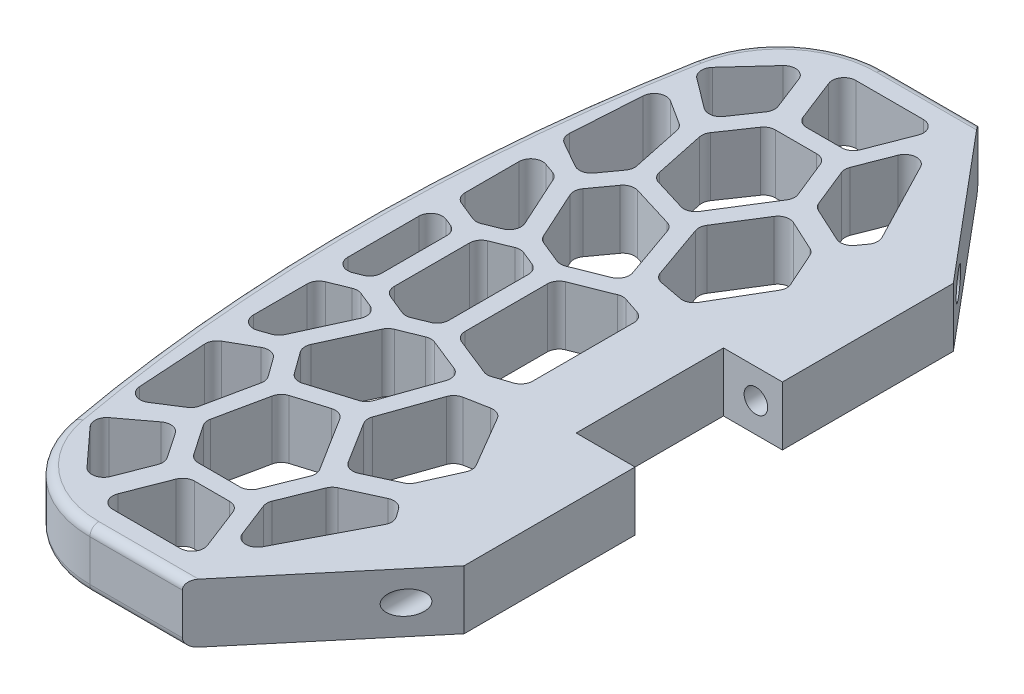
from build123d import *

# Parameters (mm, degrees)
BOSS_EXTRUDE1_DEPTH     = 10
FILLET1_R               = 3
CUT_EXTRUDE1_DEPTH      = 181.900525226
CUT_EXTRUDE1_DEPTH_BACK = 181.900525226
SKETCH2_R               = 4


with BuildPart() as part:
    # Sketch1 → Boss-Extrude1 (new, symmetric)
    with BuildSketch(Plane(origin=(0, 0, 0), x_dir=(1, 0, 0), z_dir=(0, 1, 0))):
        with BuildLine():
            Line((0, 25), (0, 83))
            Line((0, 83), (-43.633180821, 135))
            Line((-43.633180821, 135), (-75, 135))
            ThreePointArc((-75, 135), (-98.046638388, 126.655966066), (-110.409836066, 105.491803279))
            ThreePointArc((-110.409836066, 105.491803279), (-120, 0), (-110.409836066, -105.491803279))
            ThreePointArc((-110.409836066, -105.491803279), (-98.046638388, -126.655966066), (-75, -135))
            Line((-75, -135), (-43.633180821, -135))
            Line((-43.633180821, -135), (0, -83))
            Line((0, -83), (0, -25))
            Line((0, -25), (-20, -25))
            Line((-20, -25), (-20, 25))
            Line((-20, 25), (0, 25))
        make_face()
        with BuildLine():
            Line((-92.903661411, -118.071048963), (-104.314416206, -105.622682832))
            ThreePointArc((-104.314416206, -105.622682832), (-105.348741321, -102.551111688), (-103.768152023, -99.721603743))
            Line((-103.768152023, -99.721603743), (-93.663418974, -92.131293511))
            ThreePointArc((-93.663418974, -92.131293511), (-90.607698285, -91.383223133), (-87.95611023, -93.07618474))
            Line((-87.95611023, -93.07618474), (-82.152909795, -101.58768978))
            ThreePointArc((-82.152909795, -101.58768978), (-81.483446176, -103.389106237), (-81.731391874, -105.294835944))
            Line((-81.731391874, -105.294835944), (-86.228570564, -116.822007268))
            ThreePointArc((-86.228570564, -116.822007268), (-89.219305628, -119.29994155), (-92.903661411, -118.071048963))
        make_face(mode=Mode.SUBTRACT)
        with BuildLine():
            Line((-107.716713798, -85.45480826), (-109.185897217, -61.87312516))
            ThreePointArc((-109.185897217, -61.87312516), (-108.711796874, -59.721098426), (-107.16993739, -58.146722508))
            Line((-107.16993739, -58.146722508), (-98.591441924, -53.271722356))
            ThreePointArc((-98.591441924, -53.271722356), (-95.765108561, -52.840762765), (-93.373030139, -54.406600328))
            Line((-93.373030139, -54.406600328), (-88.867294221, -60.641919189))
            ThreePointArc((-88.867294221, -60.641919189), (-88.196501553, -62.154552316), (-88.195310047, -63.809248772))
            Line((-88.195310047, -63.809248772), (-91.802216554, -80.931458777))
            ThreePointArc((-91.802216554, -80.931458777), (-92.427915772, -82.384305249), (-93.567892012, -83.480989595))
            Line((-93.567892012, -83.480989595), (-101.57603347, -88.580143981))
            ThreePointArc((-101.57603347, -88.580143981), (-105.538804361, -88.770929923), (-107.716713798, -85.45480826))
        make_face(mode=Mode.SUBTRACT)
        with BuildLine():
            Line((-53.243197888, -126.067380558), (-76.169198798, -126.067380558))
            ThreePointArc((-76.169198798, -126.067380558), (-79.471871946, -124.324004158), (-79.895643883, -120.613555595))
            Line((-79.895643883, -120.613555595), (-74.359923873, -106.424394489))
            ThreePointArc((-74.359923873, -106.424394489), (-72.890102388, -104.575546304), (-70.633478788, -103.878219453))
            Line((-70.633478788, -103.878219453), (-58.751784972, -103.878219453))
            ThreePointArc((-58.751784972, -103.878219453), (-56.492419781, -104.577421226), (-55.022930664, -106.430584985))
            Line((-55.022930664, -106.430584985), (-49.51434358, -120.619746091))
            ThreePointArc((-49.51434358, -120.619746091), (-49.942399661, -124.326745749), (-53.243197888, -126.067380558))
        make_face(mode=Mode.SUBTRACT)
        with BuildLine():
            ThreePointArc((-85.489708732, -86.042690057), (-86.108665781, -84.565985031), (-86.098877878, -82.964838643))
            Line((-86.098877878, -82.964838643), (-82.455180266, -65.66797897))
            ThreePointArc((-82.455180266, -65.66797897), (-81.492665055, -63.792848275), (-79.71061556, -62.667303851))
            Line((-79.71061556, -62.667303851), (-68.758995788, -59.318917468))
            ThreePointArc((-68.758995788, -59.318917468), (-66.191217311, -59.396469443), (-64.200172027, -61.019811457))
            Line((-64.200172027, -61.019811457), (-52.796960318, -79.213385644))
            ThreePointArc((-52.796960318, -79.213385644), (-52.201794736, -80.985423607), (-52.476819935, -82.834396769))
            Line((-52.476819935, -82.834396769), (-57.536730596, -95.374919235))
            ThreePointArc((-57.536730596, -95.374919235), (-59.008619742, -97.193849041), (-61.246163135, -97.878219453))
            Line((-61.246163135, -97.878219453), (-75.306136497, -97.878219453))
            ThreePointArc((-75.306136497, -97.878219453), (-77.175189091, -97.414692611), (-78.611063662, -96.131540654))
            Line((-78.611063662, -96.131540654), (-85.489708732, -86.042690057))
        make_face(mode=Mode.SUBTRACT)
        with BuildLine():
            ThreePointArc((-104.132666249, -48.855802133), (-107.776081705, -48.351345011), (-109.467200853, -45.084990895))
            Line((-109.467200853, -45.084990895), (-109.467200853, -26.785450362))
            ThreePointArc((-109.467200853, -26.785450362), (-108.785731431, -24.552211727), (-106.973523452, -23.079915013))
            Line((-106.973523452, -23.079915013), (-100.549048075, -20.468326798))
            ThreePointArc((-100.549048075, -20.468326798), (-99.042725476, -20.173862148), (-97.536402877, -20.468326798))
            Line((-97.536402877, -20.468326798), (-92.429437297, -22.544339288))
            ThreePointArc((-92.429437297, -22.544339288), (-90.218255908, -24.773336762), (-90.297464245, -27.912043328))
            Line((-90.297464245, -27.912043328), (-98.337911629, -45.511655757))
            ThreePointArc((-98.337911629, -45.511655757), (-99.275493757, -46.800105046), (-100.641672676, -47.620298304))
            Line((-100.641672676, -47.620298304), (-104.132666249, -48.855802133))
        make_face(mode=Mode.SUBTRACT)
        with BuildLine():
            ThreePointArc((-90.632060101, -47.955570863), (-91.370518919, -46.006541571), (-91.028243615, -43.950602801))
            Line((-91.028243615, -43.950602801), (-83.466307585, -27.398396567))
            ThreePointArc((-83.466307585, -27.398396567), (-82.595792825, -26.17276524), (-81.334334533, -25.355029908))
            Line((-81.334334533, -25.355029908), (-73.785358558, -22.286325378))
            ThreePointArc((-73.785358558, -22.286325378), (-72.291756772, -21.991880956), (-70.796312421, -22.276819556))
            Line((-70.796312421, -22.276819556), (-59.788001344, -26.670386462))
            ThreePointArc((-59.788001344, -26.670386462), (-57.628848621, -28.731118927), (-57.497437693, -31.71294554))
            Line((-57.497437693, -31.71294554), (-63.878784021, -49.851045401))
            ThreePointArc((-63.878784021, -49.851045401), (-64.88305062, -51.410138826), (-66.482539605, -52.348732827))
            Line((-66.482539605, -52.348732827), (-80.925996583, -56.764725681))
            ThreePointArc((-80.925996583, -56.764725681), (-83.369608001, -56.731184975), (-85.337640324, -55.282319721))
            Line((-85.337640324, -55.282319721), (-90.632060101, -47.955570863))
        make_face(mode=Mode.SUBTRACT)
        with BuildLine():
            Line((-47.043977303, -111.24493966), (-51.583510871, -99.551891667))
            ThreePointArc((-51.583510871, -99.551891667), (-51.854569543, -98.077872496), (-51.564089102, -96.607557417))
            Line((-51.564089102, -96.607557417), (-46.327796918, -83.629889594))
            ThreePointArc((-46.327796918, -83.629889594), (-45.513232816, -82.366202314), (-44.289692518, -81.492492205))
            Line((-44.289692518, -81.492492205), (-32.712336522, -76.168044361))
            ThreePointArc((-32.712336522, -76.168044361), (-30.01966596, -75.934731591), (-27.793296277, -77.467111323))
            Line((-27.793296277, -77.467111323), (-25.858537821, -80.158099404))
            ThreePointArc((-25.858537821, -80.158099404), (-25.116544676, -82.206333495), (-25.557952149, -84.3396352))
            Line((-25.557952149, -84.3396352), (-39.766825217, -111.643810779))
            ThreePointArc((-39.766825217, -111.643810779), (-43.53404012, -113.791310112), (-47.043977303, -111.24493966))
        make_face(mode=Mode.SUBTRACT)
        with BuildLine():
            ThreePointArc((-58.867702773, -58.229870235), (-59.45388757, -56.547806551), (-59.251697806, -54.778040986))
            Line((-59.251697806, -54.778040986), (-52.741129763, -36.27264616))
            ThreePointArc((-52.741129763, -36.27264616), (-51.5738241, -34.565553665), (-49.709944902, -33.669606327))
            Line((-49.709944902, -33.669606327), (-41.851396628, -32.185886366))
            ThreePointArc((-41.851396628, -32.185886366), (-39.453295699, -32.475335944), (-37.659082514, -34.092576856))
            Line((-37.659082514, -34.092576856), (-27.485532771, -51.436056894))
            ThreePointArc((-27.485532771, -51.436056894), (-26.941717734, -53.241406998), (-27.28533147, -55.095309205))
            Line((-27.28533147, -55.095309205), (-32.572892381, -66.897900524))
            ThreePointArc((-32.572892381, -66.897900524), (-33.377285177, -68.073239302), (-34.542494472, -68.892236442))
            Line((-34.542494472, -68.892236442), (-45.017913038, -73.743077262))
            ThreePointArc((-45.017913038, -73.743077262), (-47.837272018, -73.947897777), (-50.088016189, -72.237667624))
            Line((-50.088016189, -72.237667624), (-58.867702773, -58.229870235))
        make_face(mode=Mode.SUBTRACT)
        with BuildLine():
            ThreePointArc((-104.903513467, -15.76164646), (-108.643074701, -15.374641688), (-110.409836066, -12.05611111))
            Line((-110.409836066, -12.05611111), (-110.409836066, 12.05611111))
            ThreePointArc((-110.409836066, 12.05611111), (-108.643074701, 15.374641688), (-104.903513467, 15.76164646))
            Line((-104.903513467, 15.76164646), (-102.447325525, 14.763191161))
            ThreePointArc((-102.447325525, 14.763191161), (-100.635117546, 13.290894447), (-99.953648124, 11.057655812))
            Line((-99.953648124, 11.057655812), (-99.953648124, -11.057655812))
            ThreePointArc((-99.953648124, -11.057655812), (-100.635117546, -13.290894447), (-102.447325525, -14.763191161))
            Line((-102.447325525, -14.763191161), (-104.903513467, -15.76164646))
        make_face(mode=Mode.SUBTRACT)
        with BuildLine():
            Line((-104.132666249, 48.855802133), (-100.641672676, 47.620298304))
            ThreePointArc((-100.641672676, 47.620298304), (-99.275493757, 46.800105046), (-98.337911629, 45.511655757))
            Line((-98.337911629, 45.511655757), (-90.297464245, 27.912043328))
            ThreePointArc((-90.297464245, 27.912043328), (-90.218255908, 24.773336762), (-92.429437297, 22.544339288))
            Line((-92.429437297, 22.544339288), (-97.536402877, 20.468326798))
            ThreePointArc((-97.536402877, 20.468326798), (-99.042725476, 20.173862148), (-100.549048075, 20.468326798))
            Line((-100.549048075, 20.468326798), (-106.973523452, 23.079915013))
            ThreePointArc((-106.973523452, 23.079915013), (-108.785731431, 24.552211727), (-109.467200853, 26.785450362))
            Line((-109.467200853, 26.785450362), (-109.467200853, 45.084990895))
            ThreePointArc((-109.467200853, 45.084990895), (-107.776081705, 48.351345011), (-104.132666249, 48.855802133))
        make_face(mode=Mode.SUBTRACT)
        with BuildLine():
            ThreePointArc((-93.953648124, 12.756101046), (-93.272178702, 14.989339681), (-91.459970723, 16.461636395))
            Line((-91.459970723, 16.461636395), (-84.931076073, 19.115671678))
            ThreePointArc((-84.931076073, 19.115671678), (-83.424753474, 19.410136328), (-81.918430875, 19.115671678))
            Line((-81.918430875, 19.115671678), (-77.203913224, 17.199191652))
            ThreePointArc((-77.203913224, 17.199191652), (-75.391705245, 15.726894938), (-74.710235823, 13.493656303))
            Line((-74.710235823, 13.493656303), (-74.710235823, -13.493656303))
            ThreePointArc((-74.710235823, -13.493656303), (-75.391705245, -15.726894938), (-77.203913224, -17.199191652))
            Line((-77.203913224, -17.199191652), (-81.918430875, -19.115671678))
            ThreePointArc((-81.918430875, -19.115671678), (-83.424753474, -19.410136328), (-84.931076073, -19.115671678))
            Line((-84.931076073, -19.115671678), (-91.459970723, -16.461636395))
            ThreePointArc((-91.459970723, -16.461636395), (-93.272178702, -14.989339681), (-93.953648124, -12.756101046))
            Line((-93.953648124, -12.756101046), (-93.953648124, 12.756101046))
        make_face(mode=Mode.SUBTRACT)
        with BuildLine():
            Line((-90.632060101, 47.955570863), (-85.337640324, 55.282319721))
            ThreePointArc((-85.337640324, 55.282319721), (-83.369608001, 56.731184975), (-80.925996583, 56.764725681))
            Line((-80.925996583, 56.764725681), (-66.482539605, 52.348732827))
            ThreePointArc((-66.482539605, 52.348732827), (-64.88305062, 51.410138826), (-63.878784021, 49.851045401))
            Line((-63.878784021, 49.851045401), (-57.497437693, 31.71294554))
            ThreePointArc((-57.497437693, 31.71294554), (-57.628848621, 28.731118927), (-59.788001344, 26.670386462))
            Line((-59.788001344, 26.670386462), (-70.796312421, 22.276819556))
            ThreePointArc((-70.796312421, 22.276819556), (-72.291756772, 21.991880956), (-73.785358558, 22.286325378))
            Line((-73.785358558, 22.286325378), (-81.334334533, 25.355029908))
            ThreePointArc((-81.334334533, 25.355029908), (-82.595792825, 26.17276524), (-83.466307585, 27.398396567))
            Line((-83.466307585, 27.398396567), (-91.028243615, 43.950602801))
            ThreePointArc((-91.028243615, 43.950602801), (-91.370518919, 46.006541571), (-90.632060101, 47.955570863))
        make_face(mode=Mode.SUBTRACT)
        with BuildLine():
            ThreePointArc((-93.373030139, 54.406600328), (-95.765108561, 52.840762765), (-98.591441924, 53.271722356))
            Line((-98.591441924, 53.271722356), (-107.16993739, 58.146722508))
            ThreePointArc((-107.16993739, 58.146722508), (-108.711796874, 59.721098426), (-109.185897217, 61.87312516))
            Line((-109.185897217, 61.87312516), (-107.716713798, 85.45480826))
            ThreePointArc((-107.716713798, 85.45480826), (-105.538804361, 88.770929923), (-101.57603347, 88.580143981))
            Line((-101.57603347, 88.580143981), (-93.567892012, 83.480989595))
            ThreePointArc((-93.567892012, 83.480989595), (-92.427915772, 82.384305249), (-91.802216554, 80.931458777))
            Line((-91.802216554, 80.931458777), (-88.195310047, 63.809248772))
            ThreePointArc((-88.195310047, 63.809248772), (-88.196501553, 62.154552316), (-88.867294221, 60.641919189))
            Line((-88.867294221, 60.641919189), (-93.373030139, 54.406600328))
        make_face(mode=Mode.SUBTRACT)
        with BuildLine():
            ThreePointArc((-87.95611023, 93.07618474), (-90.607698285, 91.383223133), (-93.663418974, 92.131293511))
            Line((-93.663418974, 92.131293511), (-103.768152023, 99.721603743))
            ThreePointArc((-103.768152023, 99.721603743), (-105.348741321, 102.551111688), (-104.314416206, 105.622682832))
            Line((-104.314416206, 105.622682832), (-92.903661411, 118.071048963))
            ThreePointArc((-92.903661411, 118.071048963), (-89.219305628, 119.29994155), (-86.228570564, 116.822007268))
            Line((-86.228570564, 116.822007268), (-81.731391874, 105.294835944))
            ThreePointArc((-81.731391874, 105.294835944), (-81.483446176, 103.389106237), (-82.152909795, 101.58768978))
            Line((-82.152909795, 101.58768978), (-87.95611023, 93.07618474))
        make_face(mode=Mode.SUBTRACT)
        with BuildLine():
            Line((-85.489708732, 86.042690057), (-78.611063662, 96.131540654))
            ThreePointArc((-78.611063662, 96.131540654), (-77.175189091, 97.414692611), (-75.306136497, 97.878219453))
            Line((-75.306136497, 97.878219453), (-61.246163135, 97.878219453))
            ThreePointArc((-61.246163135, 97.878219453), (-59.008619742, 97.193849041), (-57.536730596, 95.374919235))
            Line((-57.536730596, 95.374919235), (-52.476819935, 82.834396769))
            ThreePointArc((-52.476819935, 82.834396769), (-52.201794736, 80.985423607), (-52.796960318, 79.213385644))
            Line((-52.796960318, 79.213385644), (-64.200172027, 61.019811457))
            ThreePointArc((-64.200172027, 61.019811457), (-66.191217311, 59.396469443), (-68.758995788, 59.318917468))
            Line((-68.758995788, 59.318917468), (-79.71061556, 62.667303851))
            ThreePointArc((-79.71061556, 62.667303851), (-81.492665055, 63.792848275), (-82.455180266, 65.66797897))
            Line((-82.455180266, 65.66797897), (-86.098877878, 82.964838643))
            ThreePointArc((-86.098877878, 82.964838643), (-86.108665781, 84.565985031), (-85.489708732, 86.042690057))
        make_face(mode=Mode.SUBTRACT)
        with BuildLine():
            ThreePointArc((-70.633478788, 103.878219453), (-72.890102388, 104.575546304), (-74.359923873, 106.424394489))
            Line((-74.359923873, 106.424394489), (-79.895643883, 120.613555595))
            ThreePointArc((-79.895643883, 120.613555595), (-79.471871946, 124.324004158), (-76.169198798, 126.067380558))
            Line((-76.169198798, 126.067380558), (-53.243197888, 126.067380558))
            ThreePointArc((-53.243197888, 126.067380558), (-49.942399661, 124.326745749), (-49.51434358, 120.619746091))
            Line((-49.51434358, 120.619746091), (-55.022930664, 106.430584985))
            ThreePointArc((-55.022930664, 106.430584985), (-56.492419781, 104.577421226), (-58.751784972, 103.878219453))
            Line((-58.751784972, 103.878219453), (-70.633478788, 103.878219453))
        make_face(mode=Mode.SUBTRACT)
        with BuildLine():
            ThreePointArc((-66.192959361, -17.653855968), (-68.021647467, -16.18259574), (-68.710235823, -13.938814796))
            Line((-68.710235823, -13.938814796), (-68.710235823, 13.938814796))
            ThreePointArc((-68.710235823, 13.938814796), (-68.021647467, 16.18259574), (-66.192959361, 17.653855968))
            Line((-66.192959361, 17.653855968), (-53.597435718, 22.68090103))
            ThreePointArc((-53.597435718, 22.68090103), (-52.231300048, 22.964160406), (-50.850980279, 22.760985901))
            Line((-50.850980279, 22.760985901), (-45.35232675, 20.929999578))
            ThreePointArc((-45.35232675, 20.929999578), (-43.371453313, 19.474218785), (-42.616058651, 17.134873535))
            Line((-42.616058651, 17.134873535), (-42.616058651, -17.134873535))
            ThreePointArc((-42.616058651, -17.134873535), (-43.371453313, -19.474218785), (-45.35232675, -20.929999578))
            Line((-45.35232675, -20.929999578), (-50.850980279, -22.760985901))
            ThreePointArc((-50.850980279, -22.760985901), (-52.231300048, -22.964160406), (-53.597435718, -22.68090103))
            Line((-53.597435718, -22.68090103), (-66.192959361, -17.653855968))
        make_face(mode=Mode.SUBTRACT)
        with BuildLine():
            Line((-58.867702773, 58.229870235), (-50.088016189, 72.237667624))
            ThreePointArc((-50.088016189, 72.237667624), (-47.837272018, 73.947897777), (-45.017913038, 73.743077262))
            Line((-45.017913038, 73.743077262), (-34.542494472, 68.892236442))
            ThreePointArc((-34.542494472, 68.892236442), (-33.377285177, 68.073239302), (-32.572892381, 66.897900524))
            Line((-32.572892381, 66.897900524), (-27.28533147, 55.095309205))
            ThreePointArc((-27.28533147, 55.095309205), (-26.941717734, 53.241406998), (-27.485532771, 51.436056894))
            Line((-27.485532771, 51.436056894), (-37.659082514, 34.092576856))
            ThreePointArc((-37.659082514, 34.092576856), (-39.453295699, 32.475335944), (-41.851396628, 32.185886366))
            Line((-41.851396628, 32.185886366), (-49.709944902, 33.669606327))
            ThreePointArc((-49.709944902, 33.669606327), (-51.5738241, 34.565553665), (-52.741129763, 36.27264616))
            Line((-52.741129763, 36.27264616), (-59.251697806, 54.778040986))
            ThreePointArc((-59.251697806, 54.778040986), (-59.45388757, 56.547806551), (-58.867702773, 58.229870235))
        make_face(mode=Mode.SUBTRACT)
        with BuildLine():
            Line((-25.858537821, 80.158099404), (-27.793296277, 77.467111323))
            ThreePointArc((-27.793296277, 77.467111323), (-30.01966596, 75.934731591), (-32.712336522, 76.168044361))
            Line((-32.712336522, 76.168044361), (-44.289692518, 81.492492205))
            ThreePointArc((-44.289692518, 81.492492205), (-45.513232816, 82.366202314), (-46.327796918, 83.629889594))
            Line((-46.327796918, 83.629889594), (-51.564089102, 96.607557417))
            ThreePointArc((-51.564089102, 96.607557417), (-51.854569543, 98.077872496), (-51.583510871, 99.551891667))
            Line((-51.583510871, 99.551891667), (-47.043977303, 111.24493966))
            ThreePointArc((-47.043977303, 111.24493966), (-43.53404012, 113.791310112), (-39.766825217, 111.643810779))
            Line((-39.766825217, 111.643810779), (-25.557952149, 84.3396352))
            ThreePointArc((-25.557952149, 84.3396352), (-25.116544676, 82.206333495), (-25.858537821, 80.158099404))
        make_face(mode=Mode.SUBTRACT)
    extrude(amount=BOSS_EXTRUDE1_DEPTH, both=True)

    # Fillet1
    fillet1_edges = [part.edges().sort_by_distance(p)[0] for p in [
        (-59.316590411, 10, -135),
        (-98.046638388, 10, -126.655966066),
        (-59.316590411, 10, 135),
        (-98.046638388, 10, 126.655966066),
        (-59.316590411, -10, -135),
        (-98.046638388, -10, -126.655966066),
        (-59.316590411, -10, 135),
        (-98.046638388, -10, 126.655966066),
        (-120, 10, 0),
        (-120, -10, 0),
    ]]
    fillet(fillet1_edges, radius=FILLET1_R)

    # Sketch2 → Cut-Extrude1 (cut, two sides: drawn at the far end of the back side and taken through both)
    with BuildSketch(Plane.XY.offset(-CUT_EXTRUDE1_DEPTH_BACK)):
        with Locations((-9, 0)):
            Circle(SKETCH2_R)
    extrude(amount=CUT_EXTRUDE1_DEPTH + CUT_EXTRUDE1_DEPTH_BACK, mode=Mode.SUBTRACT)


solid = part.part
